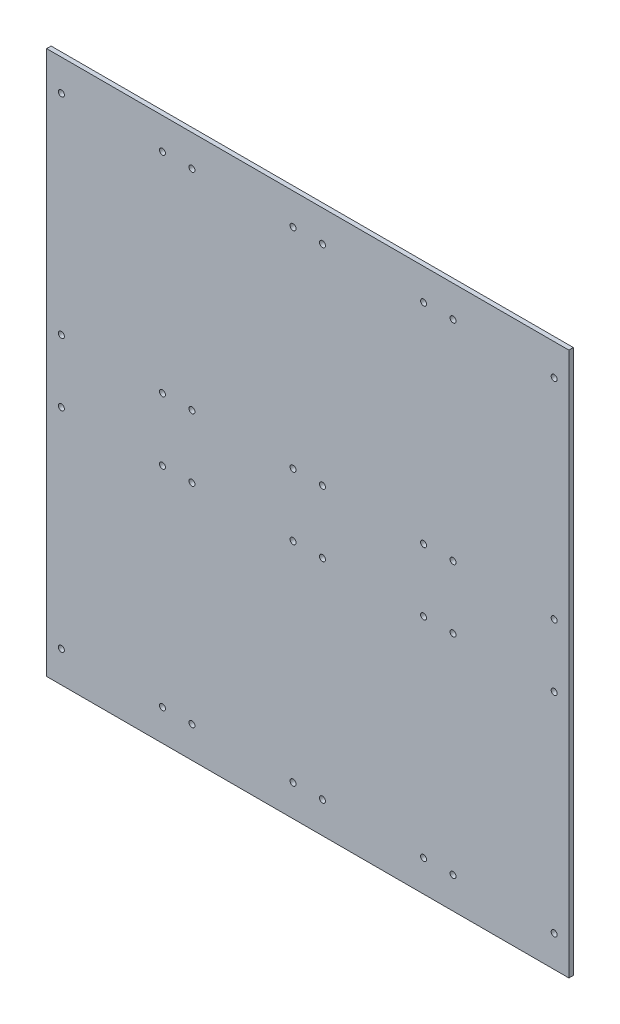
from build123d import *

# Parameters (mm, degrees)
SKETCH1_W            = 43.7
SKETCH1_H            = 91
SKETCH1_R            = 1
BOSS_EXTRUDE1_DEPTH  = 1.5
LPATTERN1_COUNT      = 4
LPATTERN1_PITCH      = 43.7
LPATTERN1_COUNT_DIR2 = 2
LPATTERN1_PITCH_DIR2 = 91


with BuildPart() as part:
    # Sketch1 → Boss-Extrude1 (new body)
    with BuildSketch(Plane.XY):
        Rectangle(SKETCH1_W, SKETCH1_H)
        with Locations((-16.92, 35)):
            Circle(SKETCH1_R, mode=Mode.SUBTRACT)
        with Locations((16.92, 35)):
            Circle(SKETCH1_R, mode=Mode.SUBTRACT)
        with Locations((16.92, -35)):
            Circle(SKETCH1_R, mode=Mode.SUBTRACT)
        with Locations((-16.92, -35)):
            Circle(SKETCH1_R, mode=Mode.SUBTRACT)
    boss_extrude1 = extrude(amount=BOSS_EXTRUDE1_DEPTH)

    # LPattern1: Boss-Extrude1 4 × 2
    with Locations(*[(-i * LPATTERN1_PITCH, j * LPATTERN1_PITCH_DIR2, 0) for i in range(LPATTERN1_COUNT) for j in range(LPATTERN1_COUNT_DIR2) if (i, j) != (0, 0)]):
        add(boss_extrude1)


solid = part.part
